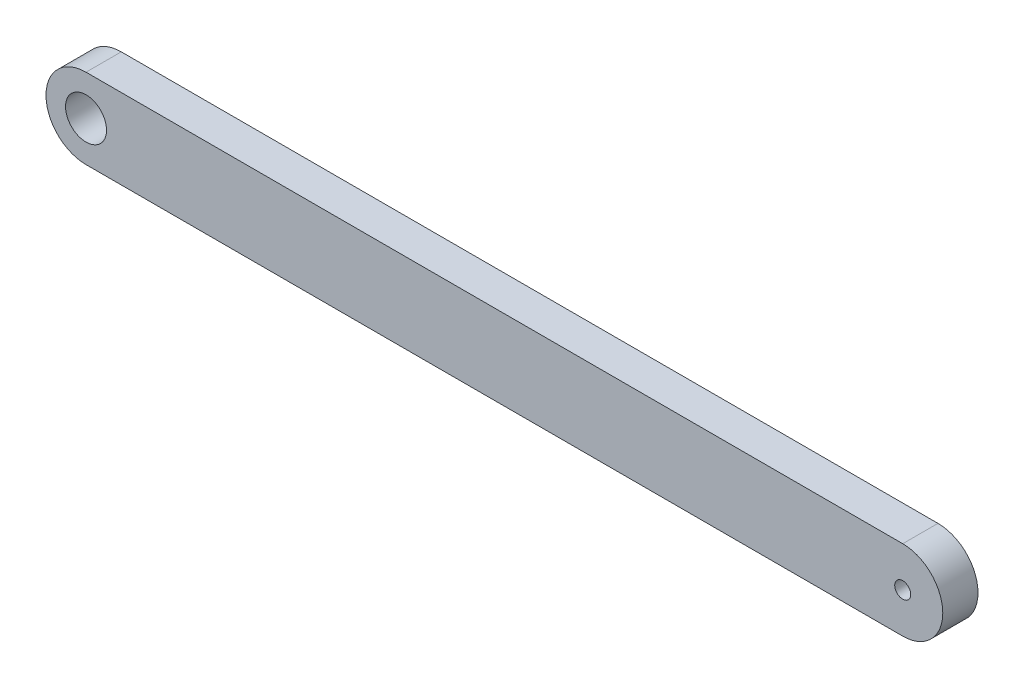
from build123d import *

# Parameters (mm, degrees)
SKETCH1_R           = 1.6
SKETCH1_R_2         = 0.625
BOSS_EXTRUDE1_DEPTH = 2.75


with BuildPart() as part:
    # Sketch1 → Boss-Extrude1 (new body)
    with BuildSketch(Plane.XY):
        with BuildLine():
            Line((0, 3.125), (63.75, 3.125))
            ThreePointArc((63.75, 3.125), (66.875, 0), (63.75, -3.125))
            Line((63.75, -3.125), (0, -3.125))
            ThreePointArc((0, -3.125), (-3.125, 0), (0, 3.125))
        make_face()
        Circle(SKETCH1_R, mode=Mode.SUBTRACT)
        with Locations((63.75, 0)):
            Circle(SKETCH1_R_2, mode=Mode.SUBTRACT)
    extrude(amount=BOSS_EXTRUDE1_DEPTH)


solid = part.part
